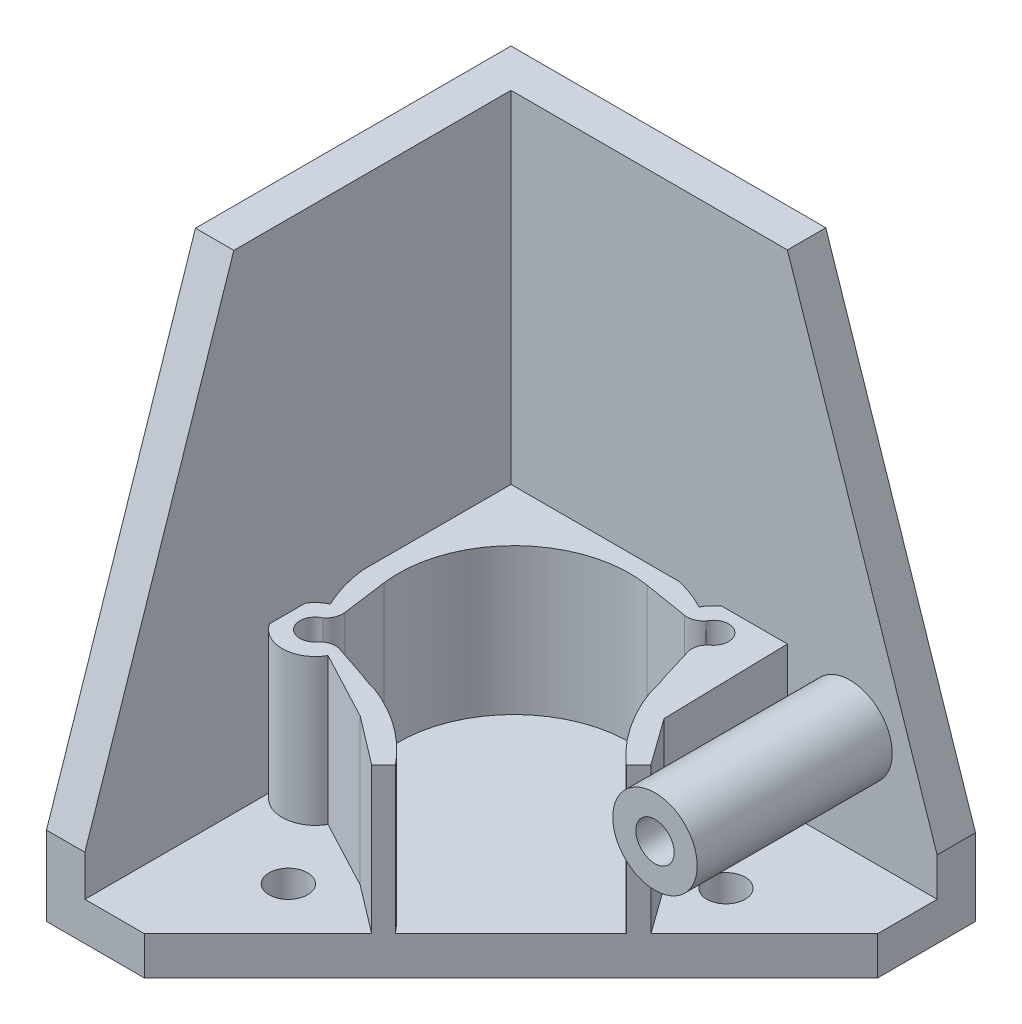
from build123d import *

# Parameters (mm, degrees)
BOSS_EXTRUDE1_DEPTH = 5
BOSS_EXTRUDE2_DEPTH = 5
BOSS_EXTRUDE3_DEPTH = 5
SKETCH6_R           = 2.5
CUT_EXTRUDE1_DEPTH  = 107.549284371
BOSS_EXTRUDE4_DEPTH = 19.05
SKETCH9_R           = 5.5
SKETCH9_R_2         = 2.5
BOSS_EXTRUDE5_DEPTH = 25.4


with BuildPart() as part:
    # Sketch1 → Boss-Extrude1 (new body)
    with BuildSketch(Plane(origin=(0, 0, 0), x_dir=(1, 0, 0), z_dir=(0, 1, 0))):
        Polygon((0, 0), (0, 60.5), (60.5, 60.5), (60.5, 47.75), (12.75, 0), align=None)
    extrude(amount=BOSS_EXTRUDE1_DEPTH)

    # Sketch4 → Boss-Extrude2 (add)
    with BuildSketch(Plane.ZY):
        Polygon((-60.5, 5), (-60.5, 68.5), (-19.4, 68.5), (0, 10.308629506), (0, 5), align=None)
    extrude(amount=-BOSS_EXTRUDE2_DEPTH)

    # Sketch5 → Boss-Extrude3 (add)
    with BuildSketch(Plane(origin=(0, 0, -60.5), x_dir=(-1, 0, 0), z_dir=(0, 0, -1))):
        Polygon((-5, 5), (-5, 68.5), (-41, 68.5), (-60.5, 10.004653177), (-60.5, 5), align=None)
    extrude(amount=-BOSS_EXTRUDE3_DEPTH)

    # Sketch6 → Cut-Extrude1 (cut, through all)
    with BuildSketch(Plane(origin=(0, 5, 0), x_dir=(1, 0, 0), z_dir=(0, 1, 0))):
        with Locations((16.5, 15)):
            Circle(SKETCH6_R)
        with Locations((45.5, 43)):
            Circle(SKETCH6_R)
    extrude(amount=-CUT_EXTRUDE1_DEPTH, mode=Mode.SUBTRACT)

    # Sketch7 → Boss-Extrude4 (add)
    with BuildSketch(Plane(origin=(0, 5, 0), x_dir=(1, 0, 0), z_dir=(0, 1, 0))):
        with BuildLine():
            Line((21.319247217, 19.543418849), (27.55028172, 14.80028172))
            Line((27.55028172, 14.80028172), (29.101515101, 16.351515101))
            ThreePointArc((29.101515101, 16.351515101), (24.666913521, 20.553458517), (19.305449591, 23.482062993))
            ThreePointArc((19.305449591, 23.482062993), (18.064972723, 23.830124106), (16.858784616, 24.282937146))
            Line((16.858784616, 24.282937146), (12.384629863, 25.774635894))
            ThreePointArc((12.384629863, 25.774635894), (11.23817984, 25.813438697), (10.255553875, 25.221577628))
            ThreePointArc((10.255553875, 25.221577628), (7.080749695, 25.107920962), (7.801379157, 28.201946269))
            ThreePointArc((7.801379157, 28.201946269), (8.483986824, 29.116932404), (8.624672831, 30.249787338))
            Line((8.624672831, 30.249787338), (7.827322243, 36.113739602))
            ThreePointArc((7.827322243, 36.113739602), (12.250646005, 48.939477405), (25.194853904, 53.00307497))
            Line((25.194853904, 53.00307497), (31.034265028, 52.042355532))
            ThreePointArc((31.034265028, 52.042355532), (32.170605503, 52.151365529), (33.104288638, 52.808167369))
            ThreePointArc((33.104288638, 52.808167369), (36.217223203, 53.44215303), (36.014993038, 50.271758357))
            ThreePointArc((36.014993038, 50.271758357), (35.395934706, 49.306035781), (35.402721719, 48.158949364))
            Line((35.402721719, 48.158949364), (36.768952902, 43.644900376))
            ThreePointArc((36.768952902, 43.644900376), (37.18792138, 42.426542952), (37.501221649, 41.17683405))
            ThreePointArc((37.501221649, 41.17683405), (40.195217667, 35.858711581), (44.131223781, 31.381223781))
            Line((44.131223781, 31.381223781), (45.737755925, 32.987755925))
            Line((45.737755925, 32.987755925), (41.382120343, 39.053882356))
            Line((41.382120343, 39.053882356), (41, 55.5))
            Line((41, 55.5), (32.491282289, 55.5))
            ThreePointArc((32.491282289, 55.5), (31.691168489, 54.800352321), (31.086863185, 53.925993089))
            ThreePointArc((31.086863185, 53.925993089), (29.049863177, 54.843826537), (26.91416103, 55.5))
            Line((26.91416103, 55.5), (5, 55.5))
            Line((5, 55.5), (5, 36.259130968))
            ThreePointArc((5, 36.259130968), (5.604814931, 33.17761818), (6.740301049, 30.249787338))
            ThreePointArc((6.740301049, 30.249787338), (5.763456299, 29.595667883), (5, 28.701669892))
            Line((5, 28.701669892), (5, 24.05684885))
            ThreePointArc((5, 24.05684885), (8.756409057, 22.076412717), (12.384629863, 24.282937146))
            Line((12.384629863, 24.282937146), (21.319247217, 19.543418849))
        make_face()
    extrude(amount=BOSS_EXTRUDE4_DEPTH)

    # Sketch9 → Boss-Extrude5 (add)
    with BuildSketch(Plane.XY.offset(-55.5)):
        with Locations((49.152306284, 18.55)):
            Circle(SKETCH9_R)
        with Locations((49.152306284, 18.55)):
            Circle(SKETCH9_R_2, mode=Mode.SUBTRACT)
    extrude(amount=BOSS_EXTRUDE5_DEPTH)


solid = part.part
